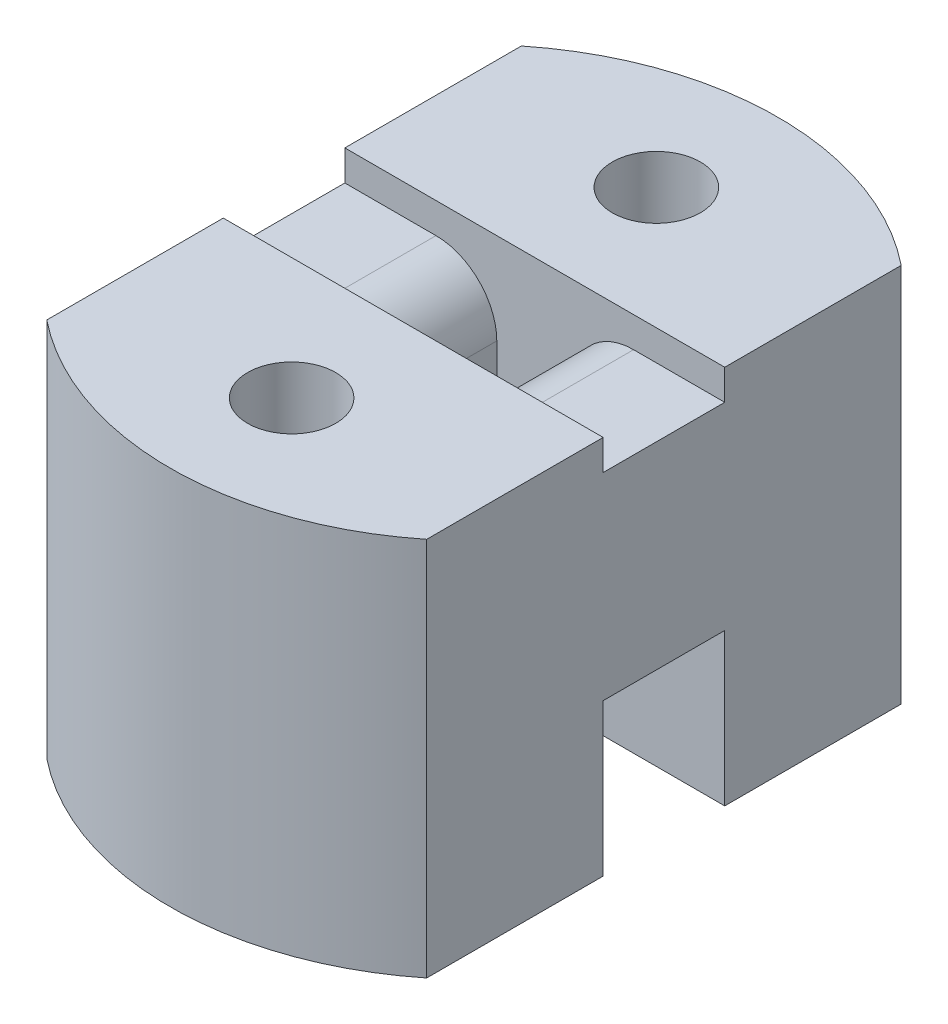
from build123d import *

# Parameters (mm, degrees)
SKETCH1_R               = 20
BOSS_EXTRUDE1_DEPTH     = 25
SKETCH2_W               = 40
SKETCH2_H               = 8
CUT_EXTRUDE1_DEPTH      = 2
M5_CLEARANCE_HOLE1_D    = 5.8
CUT_EXTRUDE2_DEPTH      = 6
CUT_EXTRUDE3_DEPTH      = 37.455452267
CUT_EXTRUDE3_DEPTH_BACK = 37.455452267
SKETCH6_W               = 5
SKETCH6_H               = 8
SKETCH7_W               = 40
SKETCH7_H               = 8
CUT_EXTRUDE4_DEPTH      = 10
FILLET1_R               = 4
SKETCH8_OUTSIDE_W       = 54.37
SKETCH8_OUTSIDE_H       = 54.37
SKETCH8_OUTSIDE_W_2     = 25
SKETCH8_OUTSIDE_H_2     = 40
CUT_EXTRUDE5_DEPTH      = 38.749172176


with BuildPart() as part:
    # Sketch1 → Boss-Extrude1 (new body)
    with BuildSketch(Plane(origin=(0, 0, 0), x_dir=(1, 0, 0), z_dir=(0, 1, 0))):
        Circle(SKETCH1_R)
    extrude(amount=BOSS_EXTRUDE1_DEPTH)

    # Sketch2 → Cut-Extrude1 (cut)
    with BuildSketch(Plane(origin=(0, 25, 0), x_dir=(1, 0, 0), z_dir=(0, 1, 0))):
        Rectangle(SKETCH2_W, SKETCH2_H)
    extrude(amount=-CUT_EXTRUDE1_DEPTH, mode=Mode.SUBTRACT)

    # M5 Clearance Hole1 (through all)
    with Locations(Plane(origin=(0, 25, -12), x_dir=(0, 0, 1), z_dir=(0, 1, 0))):
        with Locations((0, 0), (24, 0)):
            Hole(M5_CLEARANCE_HOLE1_D / 2)

    # Sketch5 → Cut-Extrude2 (cut)
    with BuildSketch(Plane.XZ):
        Polygon((4.907477288, 12), (2.453738644, 16.25), (-2.453738644, 16.25), (-4.907477288, 12), (-2.453738644, 7.75), (2.453738644, 7.75), align=None)
        Polygon((4.907477288, -12), (2.453738644, -7.75), (-2.453738644, -7.75), (-4.907477288, -12), (-2.453738644, -16.25), (2.453738644, -16.25), align=None)
    extrude(amount=-CUT_EXTRUDE2_DEPTH, mode=Mode.SUBTRACT)

    # Sketch6 → Cut-Extrude3 (cut, two sides: drawn at the far end of the back side and taken through both)
    with BuildSketch(Plane(origin=(0, 23, 0), x_dir=(1, 0, 0), z_dir=(0, 1, 0)).offset(-CUT_EXTRUDE3_DEPTH_BACK)):
        Rectangle(SKETCH6_W, SKETCH6_H)
    extrude(amount=CUT_EXTRUDE3_DEPTH + CUT_EXTRUDE3_DEPTH_BACK, mode=Mode.SUBTRACT)

    # Sketch7 → Cut-Extrude4 (cut)
    with BuildSketch(Plane.XZ):
        Rectangle(SKETCH7_W, SKETCH7_H)
    extrude(amount=-CUT_EXTRUDE4_DEPTH, mode=Mode.SUBTRACT)

    # Fillet1
    fillet1_edges = [part.edges().sort_by_distance(p)[0] for p in [
        (-2.5, 23, 0),
        (2.5, 23, 0),
        (-2.5, 10, 0),
        (2.5, 10, 0),
    ]]
    fillet(fillet1_edges, radius=FILLET1_R)

    # Sketch8 outside → Cut-Extrude5 (cut, through all)
    with BuildSketch(Plane(origin=(0, 25, 0), x_dir=(1, 0, 0), z_dir=(0, 1, 0))):
        Rectangle(SKETCH8_OUTSIDE_W, SKETCH8_OUTSIDE_H)
        Rectangle(SKETCH8_OUTSIDE_W_2, SKETCH8_OUTSIDE_H_2, mode=Mode.SUBTRACT)
    extrude(amount=-CUT_EXTRUDE5_DEPTH, mode=Mode.SUBTRACT)


solid = part.part
